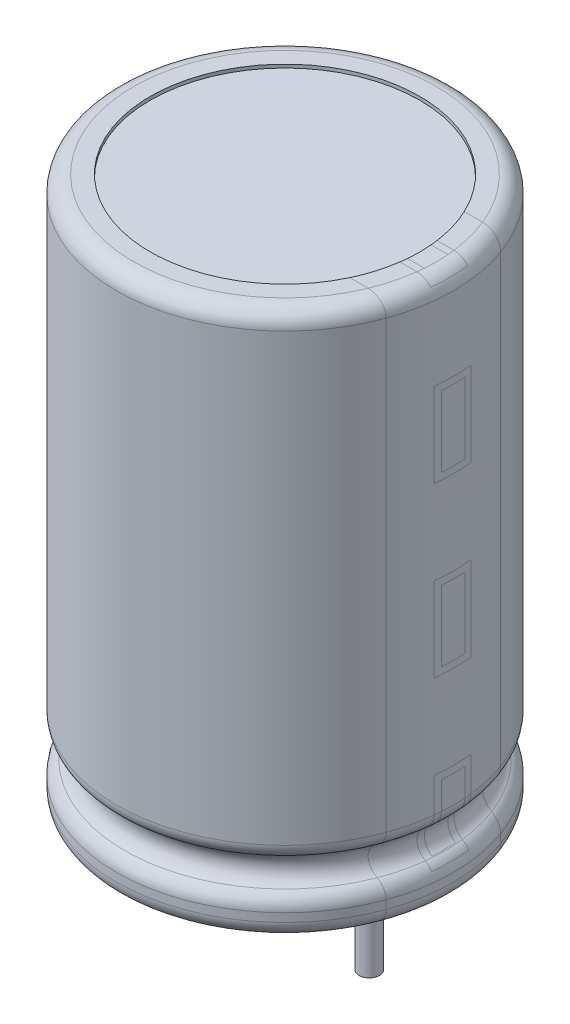
from build123d import *

# Parameters (mm, degrees)
BOSS_EXTRUDE1_DEPTH        = 1
BOSS_EXTRUDE1_DEPTH_BACK   = 3
SKETCH1_R                  = 0.3
BOSS_EXTRUDE1_2_DEPTH      = 1
BOSS_EXTRUDE1_2_DEPTH_BACK = 3


with BuildPart() as part:
    # Sketch1 → Boss-Extrude1 (new, two sides: drawn at the far end of the back side and taken through both)
    with BuildSketch(Plane(origin=(0, 0, 0), x_dir=(1, 0, 0), z_dir=(0, 1, 0)).offset(-BOSS_EXTRUDE1_DEPTH_BACK)):
        with Locations((-2.5, 0)):
            Circle(SKETCH1_R)
    extrude(amount=BOSS_EXTRUDE1_DEPTH + BOSS_EXTRUDE1_DEPTH_BACK)



with BuildPart() as body_2:
    # Sketch1 → Boss-Extrude1 2 (new, two sides: drawn at the far end of the back side and taken through both)
    with BuildSketch(Plane(origin=(0, 0, 0), x_dir=(1, 0, 0), z_dir=(0, 1, 0)).offset(-BOSS_EXTRUDE1_2_DEPTH_BACK)):
        with Locations((2.5, 0)):
            Circle(SKETCH1_R)
    extrude(amount=BOSS_EXTRUDE1_2_DEPTH + BOSS_EXTRUDE1_2_DEPTH_BACK)


with BuildPart() as part_1:
    add(part.part)

    add(body_2.part)  # Revolve1 merges body 2
    # Sketch3 → Revolve1 (revolve)
    with BuildSketch(Plane.XY):
        with BuildLine():
            Line((5, 0.5), (5, 0.75))
            ThreePointArc((5, 0.75), (4.933012702, 1), (4.75, 1.183012702))
            ThreePointArc((4.75, 1.183012702), (4.5, 1.616025404), (4.75, 2.049038106))
            ThreePointArc((4.75, 2.049038106), (4.933012702, 2.232050808), (5, 2.482050808))
            Line((5, 2.482050808), (5, 15.7))
            ThreePointArc((5, 15.7), (4.853553391, 16.053553391), (4.5, 16.2))
            Line((4.5, 16.2), (4, 16.2))
            Line((4, 16.2), (4, 16.1))
            Line((4, 16.1), (0, 16.1))
            Line((0, 16.1), (0, 0.1))
            Line((0, 0.1), (4, 0.1))
            Line((4, 0.1), (4, 0))
            Line((4, 0), (4.5, 0))
            ThreePointArc((4.5, 0), (4.853553391, 0.146446609), (5, 0.5))
        make_face()
    revolve(axis=Axis((0, 0.1, 0), (0, 1, 0)))


solid = part_1.part
